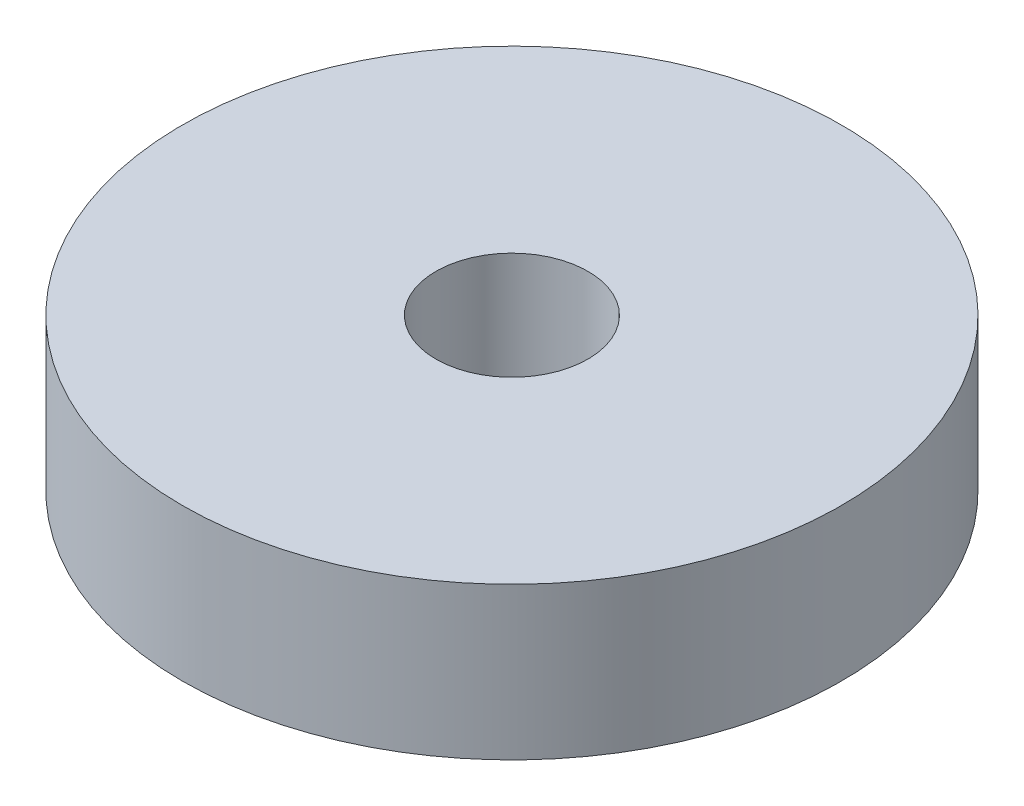
from build123d import *

# Parameters (mm, degrees)
SKETCH_1_R      = 32.5
SKETCH_1_R_2    = 7.5
EXTRUDE_1_DEPTH = 15


with BuildPart() as part:
    # 草圖1 → 填料-伸長1 (new body)
    with BuildSketch(Plane(origin=(0, 0, 0), x_dir=(1, 0, 0), z_dir=(0, 1, 0))):
        Circle(SKETCH_1_R)
        Circle(SKETCH_1_R_2, mode=Mode.SUBTRACT)
    extrude(amount=EXTRUDE_1_DEPTH)


solid = part.part
